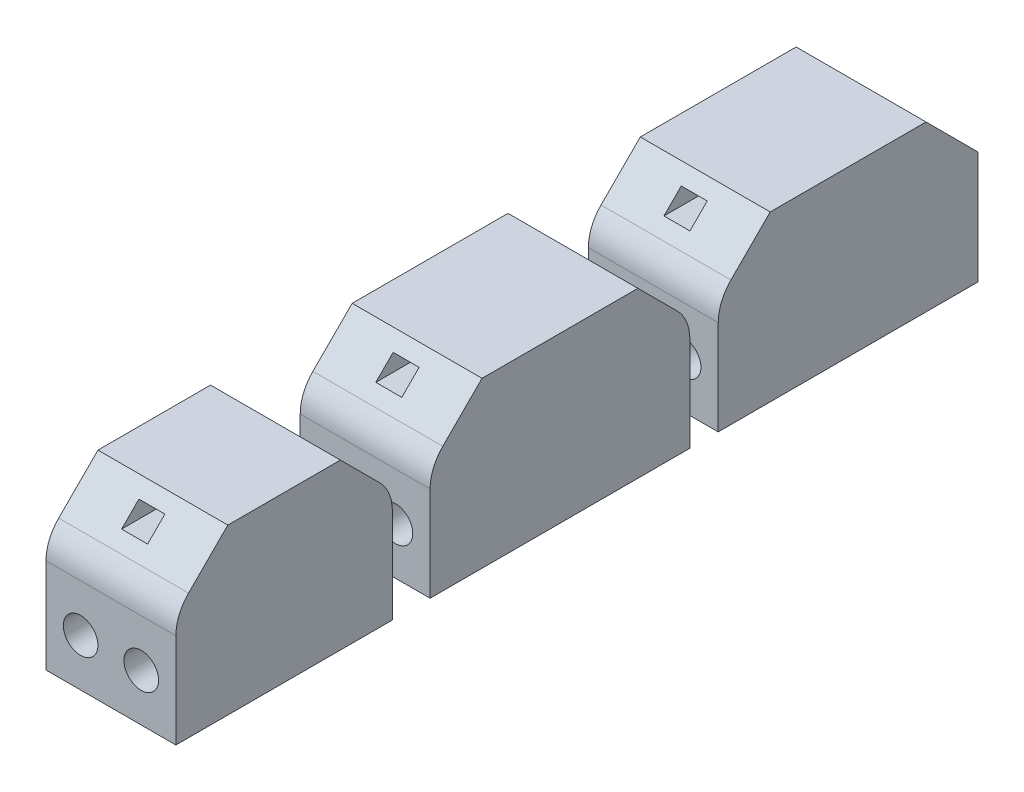
from build123d import *

# Parameters (mm, degrees)
BOSS_EXTRUDE1_DEPTH = 7.5
BOSS_EXTRUDE2_DEPTH = 7.5
BOSS_EXTRUDE3_DEPTH = 7.5
FILLET1_R           = 5
FILLET2_R           = 5
FILLET3_R           = 5
SKETCH4_R           = 2
SKETCH4_W           = 3
SKETCH4_H           = 2
CUT_EXTRUDE1_DEPTH  = 100


with BuildPart() as part:
    # Sketch1 → Boss-Extrude1 (new, symmetric)
    with BuildSketch(Plane(origin=(0, 0, 0), x_dir=(0, 0, -1), z_dir=(1, 0, 0))):
        Polygon((-31.324369962, -10.21673477), (-37.324369962, -16.21673477), (-37.324369962, -29.21673477), (-12.324369962, -29.21673477), (-12.324369962, -16.21673477), (-18.324369962, -10.21673477), align=None)
    extrude(amount=BOSS_EXTRUDE1_DEPTH, both=True)

    # Fillet3
    fillet3_edges = [part.edges().sort_by_distance(p)[0] for p in [
        (0, -16.21673477, 37.324369962),
        (0, -16.21673477, 12.324369962),
    ]]
    fillet(fillet3_edges, radius=FILLET3_R)


with BuildPart() as body_2:
    # Sketch2 → Boss-Extrude2 (new, symmetric)
    with BuildSketch(Plane(origin=(0, 0, 0), x_dir=(0, 0, -1), z_dir=(1, 0, 0))):
        Polygon((-7.967160281, -29.21673477), (-7.967160281, -16.21673477), (-1.967160281, -10.21673477), (16.032839719, -10.21673477), (22.032839719, -16.21673477), (22.032839719, -29.21673477), align=None)
    extrude(amount=BOSS_EXTRUDE2_DEPTH, both=True)

    # Fillet2
    fillet2_edges = [body_2.edges().sort_by_distance(p)[0] for p in [
        (0, -16.21673477, 7.967160281),
        (0, -16.21673477, -22.032839719),
    ]]
    fillet(fillet2_edges, radius=FILLET2_R)


with BuildPart() as body_3:
    # Sketch3 → Boss-Extrude3 (new, symmetric)
    with BuildSketch(Plane(origin=(0, 0, 0), x_dir=(0, 0, -1), z_dir=(1, 0, 0))):
        Polygon((25.31118522, -16.21673477), (25.31118522, -29.21673477), (55.31118522, -29.21673477), (55.31118522, -16.21673477), (49.31118522, -10.21673477), (31.31118522, -10.21673477), align=None)
    extrude(amount=BOSS_EXTRUDE3_DEPTH, both=True)

    # Fillet1
    fillet1_edges = [body_3.edges().sort_by_distance(p)[0] for p in [
        (0, -16.21673477, -25.31118522),
    ]]
    fillet(fillet1_edges, radius=FILLET1_R)


with BuildPart() as cut_extrude1_tool:
    # Sketch4 → Cut-Extrude1 (new, symmetric)
    with BuildSketch(Plane.XY):
        with Locations((-3.5, -23.752268676)):
            Circle(SKETCH4_R)
        with Locations((3.5, -23.752268676)):
            Circle(SKETCH4_R)
        with Locations((0, -12.484501723)):
            Rectangle(SKETCH4_W, SKETCH4_H)
    extrude(amount=CUT_EXTRUDE1_DEPTH, both=True)


with BuildPart() as part_1:
    add(part.part)

    # Cut-Extrude1: cut by cut_extrude1_tool
    add(cut_extrude1_tool.part, mode=Mode.SUBTRACT)


with BuildPart() as body_2_1:
    add(body_2.part)

    # Cut-Extrude1: cut by cut_extrude1_tool
    add(cut_extrude1_tool.part, mode=Mode.SUBTRACT)


with BuildPart() as body_3_1:
    add(body_3.part)

    # Cut-Extrude1: cut by cut_extrude1_tool
    add(cut_extrude1_tool.part, mode=Mode.SUBTRACT)


solid = Compound([part_1.part, body_2_1.part, body_3_1.part])
